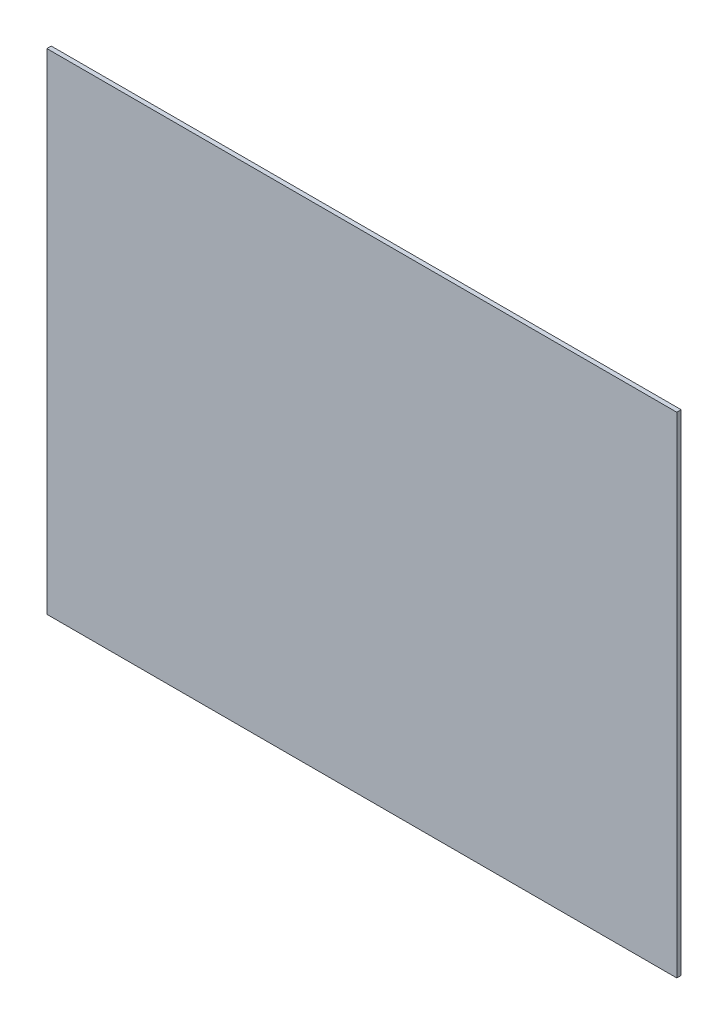
from build123d import *

# Parameters (mm, degrees)
SKETCH1_W           = 914.4
SKETCH1_H           = 711.2
BOSS_EXTRUDE1_DEPTH = 6.35


with BuildPart() as part:
    # Sketch1 → Boss-Extrude1 (new body)
    with BuildSketch(Plane.XY):
        Rectangle(SKETCH1_W, SKETCH1_H)
    extrude(amount=BOSS_EXTRUDE1_DEPTH)


solid = part.part
